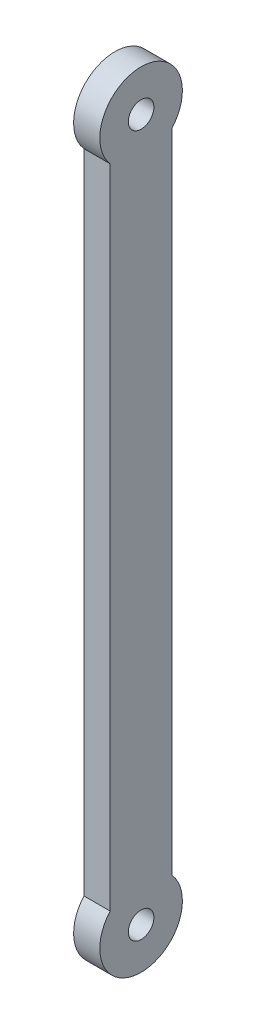
from build123d import *

# Parameters (mm, degrees)
SKETCH1_R           = 1.55
BOSS_EXTRUDE3_DEPTH = 3.175


with BuildPart() as part:
    # Sketch1 → Boss-Extrude3 (new body)
    with BuildSketch(Plane(origin=(0, 0, 0), x_dir=(0, 0, -1), z_dir=(1, 0, 0))):
        with BuildLine():
            Line((3.75, -3.307189139), (3.75, -81.692810861))
            ThreePointArc((3.75, -81.692810861), (0, -90), (-3.75, -81.692810861))
            Line((-3.75, -81.692810861), (-3.75, -3.307189139))
            ThreePointArc((-3.75, -3.307189139), (0, 5), (3.75, -3.307189139))
        make_face()
        Circle(SKETCH1_R, mode=Mode.SUBTRACT)
        with Locations((0, -85)):
            Circle(SKETCH1_R, mode=Mode.SUBTRACT)
    extrude(amount=BOSS_EXTRUDE3_DEPTH)


solid = part.part
